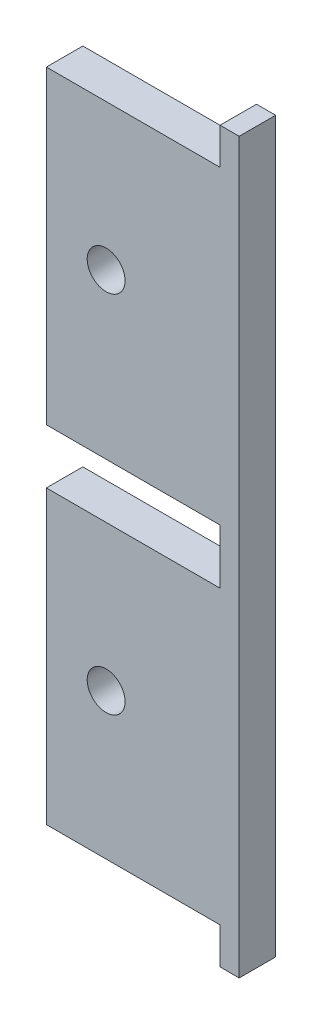
from build123d import *

# Parameters (mm, degrees)
SKETCH2_W               = 40.64
SKETCH2_H               = 127
BOSS_EXTRUDE1_DEPTH     = 6.35
M6_CLEARANCE_HOLE1_D    = 6.6
CUT_EXTRUDE1_DEPTH      = 134.495063954
CUT_EXTRUDE1_DEPTH_BACK = 134.495063954
SKETCH5_W               = 7.0505
SKETCH5_H               = 127
SKETCH6_W               = 30.25575
SKETCH6_H               = 6.35
SKETCH6_H_2             = 9.525
CUT_EXTRUDE2_DEPTH      = 134.495063954


with BuildPart() as part:
    # Sketch2 → Boss-Extrude1 (new body)
    with BuildSketch(Plane.XY):
        with Locations((20.32, 63.5)):
            Rectangle(SKETCH2_W, SKETCH2_H)
    extrude(amount=BOSS_EXTRUDE1_DEPTH)

    # M6 Clearance Hole1 (through all)
    with Locations(Plane.XY.offset(6.35)):
        with Locations((17.4625, 31.75), (17.4625, 95.25)):
            Hole(M6_CLEARANCE_HOLE1_D / 2)

    # Sketch5 → Cut-Extrude1 (cut, two sides: drawn at the far end of the back side and taken through both)
    with BuildSketch(Plane.XY.offset(6.35).offset(-CUT_EXTRUDE1_DEPTH_BACK)):
        with Locations((3.52525, 63.5)):
            Rectangle(SKETCH5_W, SKETCH5_H)
    extrude(amount=CUT_EXTRUDE1_DEPTH + CUT_EXTRUDE1_DEPTH_BACK, mode=Mode.SUBTRACT)

    # Sketch6 → Cut-Extrude2 (cut, through all)
    with BuildSketch(Plane.XY.offset(6.35)):
        with Locations((22.178375, 123.825)):
            Rectangle(SKETCH6_W, SKETCH6_H)
        with Locations((22.178375, 61.9125)):
            Rectangle(SKETCH6_W, SKETCH6_H_2)
        with Locations((22.178375, 3.175)):
            Rectangle(SKETCH6_W, SKETCH6_H)
    extrude(amount=-CUT_EXTRUDE2_DEPTH, mode=Mode.SUBTRACT)


solid = part.part
